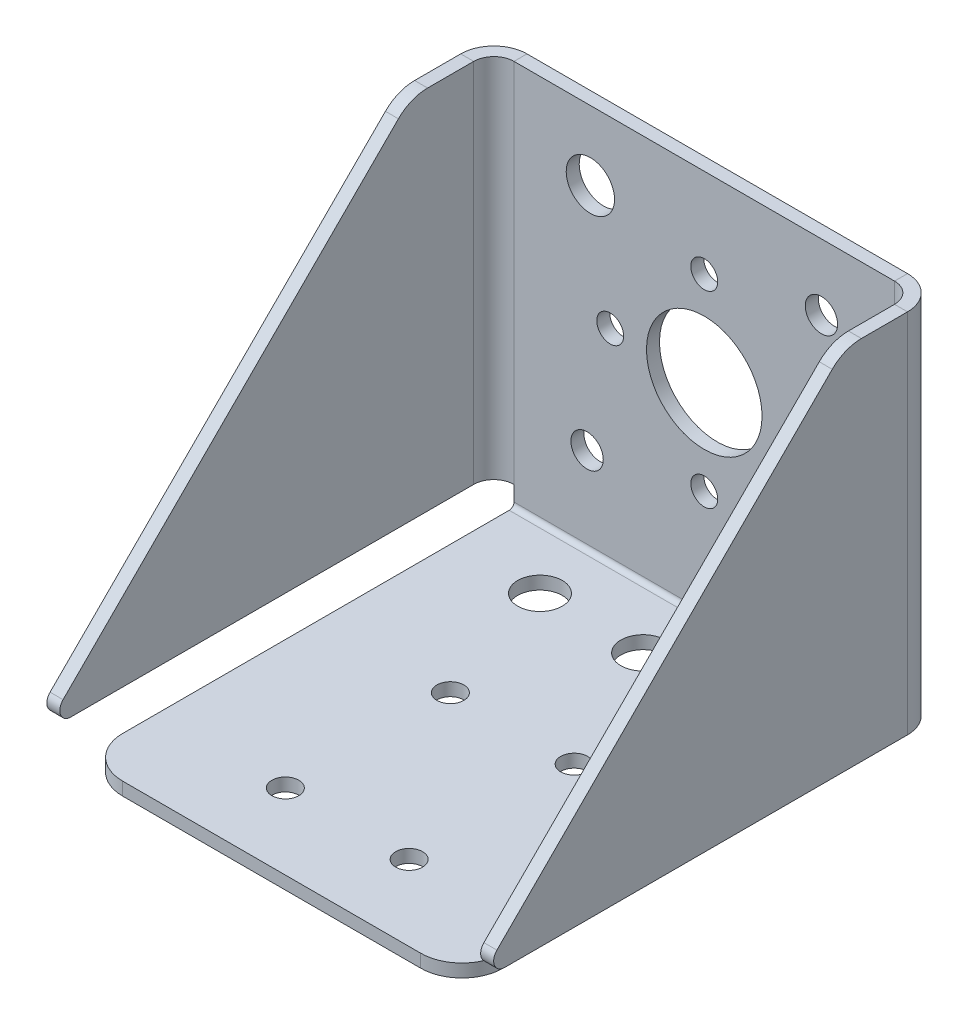
from build123d import *

# Parameters (mm, degrees)
BASE_FLANGE1_DEPTH      = 56.388
EDGE_FLANGE2_DEPTH      = 58.5724
BREAK_CORNER3_START     = 1.706248663
BREAK_CORNER3_OUTLINE_W = 2
BREAK_CORNER3_OUTLINE_H = 81
BREAK_CORNER3_DEPTH     = 38.166088515
BREAK_CORNER4_START     = 1.706248663
BREAK_CORNER4_OUTLINE_W = 2
BREAK_CORNER4_OUTLINE_H = 81
BREAK_CORNER4_DEPTH     = 38.166088515
SKETCH21_R              = 8.89
SKETCH21_R_2            = 3.7211
SKETCH21_R_3            = 2.4892
SKETCH21_R_4            = 2.0701
CUT_EXTRUDE1_DEPTH      = 112.227490523
SKETCH22_R              = 3.429
CUT_EXTRUDE2_DEPTH      = 114.887063041
SKETCH23_R              = 2.0701
CUT_EXTRUDE3_DEPTH      = 114.887063041
FILLET1_R               = 6.35
CUT_EXTRUDE4_DEPTH      = 73.406


# Read off the part's stored shape, not the designer's step: Base-Flange1, Break-Corner3, Break-Corner4
# Sheet-metal steps are written as plain solids
with BuildPart() as part:
    # Base-Flange1 outline → Base-Flange1 (new body)
    with BuildSketch(Plane(origin=(0, 0, 0), x_dir=(1, 0, 0), z_dir=(0, 1, 0))):
        with BuildLine():
            Line((-66.77, 63.7032), (-66.77, 0))
            Line((-66.77, 0), (-64.77, 0))
            Line((-64.77, 0), (-64.77, 63.7032))
            ThreePointArc((-64.77, 63.7032), (-63.862382494, 65.894382494), (-61.6712, 66.802))
            Line((-61.6712, 66.802), (-3.0988, 66.802))
            ThreePointArc((-3.0988, 66.802), (-0.907617506, 65.894382494), (0, 63.7032))
            Line((0, 63.7032), (0, 0))
            Line((0, 0), (2, 0))
            Line((2, 0), (2, 63.7032))
            ThreePointArc((2, 63.7032), (0.506596056, 67.308596056), (-3.0988, 68.802))
            Line((-3.0988, 68.802), (-61.6712, 68.802))
            ThreePointArc((-61.6712, 68.802), (-65.276596056, 67.308596056), (-66.77, 63.7032))
        make_face()
    extrude(amount=BASE_FLANGE1_DEPTH)

    # Edge-Flange2 section (across the edge) → Edge-Flange2 (add)
    with BuildSketch(Plane(origin=(-61.6712, -5.08, -66.802), x_dir=(0, 1, 0), z_dir=(1, 0, 0))):
        with BuildLine():
            Line((0, 0.7366), (0, 66.58))
            Line((0, 66.58), (2, 66.58))
            Line((2, 66.58), (2, 0.7366))
            ThreePointArc((2, 0.7366), (2.215745145, 0.215745145), (2.7366, 0))
            Line((2.7366, 0), (5.08, 0))
            Line((5.08, 0), (5.08, -2))
            Line((5.08, -2), (2.7366, -2))
            ThreePointArc((2.7366, -2), (0.801531583, -1.198468417), (0, 0.7366))
        make_face()
    extrude(amount=EDGE_FLANGE2_DEPTH)

    # Break-Corner3 outline → Break-Corner3 (cut)
    with BuildSketch(Plane(origin=(0, 0, 0), x_dir=(1, 0, 0), z_dir=(0, 0.7071067811865476, 0.7071067811865476)).offset(BREAK_CORNER3_START)):
        with Locations((-65.77, 39.5)):
            Rectangle(BREAK_CORNER3_OUTLINE_W, BREAK_CORNER3_OUTLINE_H)
    extrude(amount=BREAK_CORNER3_DEPTH, mode=Mode.SUBTRACT)

    # Break-Corner4 outline → Break-Corner4 (cut)
    with BuildSketch(Plane(origin=(0, 0, 0), x_dir=(1, 0, 0), z_dir=(0, 0.7071067811865476, 0.7071067811865476)).offset(BREAK_CORNER4_START)):
        with Locations((1, 39.5)):
            Rectangle(BREAK_CORNER4_OUTLINE_W, BREAK_CORNER4_OUTLINE_H)
    extrude(amount=BREAK_CORNER4_DEPTH, mode=Mode.SUBTRACT)

    # Sketch21 → Cut-Extrude1 (cut, through all)
    with BuildSketch(Plane(origin=(0, 0, -68.802), x_dir=(-1, 0, 0), z_dir=(0, 0, -1))):
        with Locations((32.385, 28.194)):
            Circle(SKETCH21_R)
        with Locations((49.911, 45.72)):
            Circle(SKETCH21_R_2)
        with Locations((14.859, 10.668)):
            Circle(SKETCH21_R_2)
        with Locations((14.351, 46.228)):
            Circle(SKETCH21_R_3)
        with Locations((50.419, 10.16)):
            Circle(SKETCH21_R_3)
        with Locations((32.385, 42.672)):
            Circle(SKETCH21_R_4)
        with Locations((17.907, 28.194)):
            Circle(SKETCH21_R_4)
        with Locations(Location((32.385, 13.716, 0), (0, 0, 180))):
            Circle(SKETCH21_R_4)
        with Locations(Location((46.863, 28.194, 0), (0, 0, 180))):
            Circle(SKETCH21_R_4)
    extrude(amount=-CUT_EXTRUDE1_DEPTH, mode=Mode.SUBTRACT)

    # Sketch22 → Cut-Extrude2 (cut, through all)
    with BuildSketch(Plane.XZ.offset(5.08)):
        with Locations(Location((-48.238156, -57.372, 0), (0, 0, 270))):
            Circle(SKETCH22_R)
        with Locations(Location((-16.488156, -57.372, 0), (0, 0, 270))):
            Circle(SKETCH22_R)
        with Locations(Location((-32.363156, -57.372, 0), (0, 0, 270))):
            Circle(SKETCH22_R)
    extrude(amount=-CUT_EXTRUDE2_DEPTH, mode=Mode.SUBTRACT)

    # Sketch23 → Cut-Extrude3 (cut, through all)
    with BuildSketch(Plane.XZ.offset(5.08)):
        with Locations(Location((-41.888156, -37.23234, 0), (0, 0, 270))):
            Circle(SKETCH23_R)
        with Locations(Location((-41.888156, -11.83234, 0), (0, 0, 270))):
            Circle(SKETCH23_R)
        with Locations(Location((-22.838156, -37.23234, 0), (0, 0, 270))):
            Circle(SKETCH23_R)
        with Locations(Location((-22.838156, -11.83234, 0), (0, 0, 270))):
            Circle(SKETCH23_R)
    extrude(amount=-CUT_EXTRUDE3_DEPTH, mode=Mode.SUBTRACT)

    # Fillet1
    fillet1_edges = [part.edges().sort_by_distance(p)[0] for p in [
        (-61.6712, -4.08, -0.222),
        (-3.0988, -4.08, -0.222),
        (-65.77, 56.388, -53.975),
        (1, 56.388, -53.975),
    ]]
    fillet(fillet1_edges, radius=FILLET1_R)

    # Sketch24 → Cut-Extrude4 (cut)
    with BuildSketch(Plane.ZY.offset(66.77)):
        with BuildLine():
            Line((-0.499748663, 2.912748663), (0, 2.413))
            Line((0, 2.413), (1.847190311, 1.053295568))
            Line((1.847190311, 1.053295568), (0, 0))
            Line((0, 0), (-1.706248663, 0))
            ThreePointArc((-1.706248663, 0), (-0.129880446, 1.053295568), (-0.499748663, 2.912748663))
        make_face()
    extrude(amount=-CUT_EXTRUDE4_DEPTH, mode=Mode.SUBTRACT)


solid = part.part
